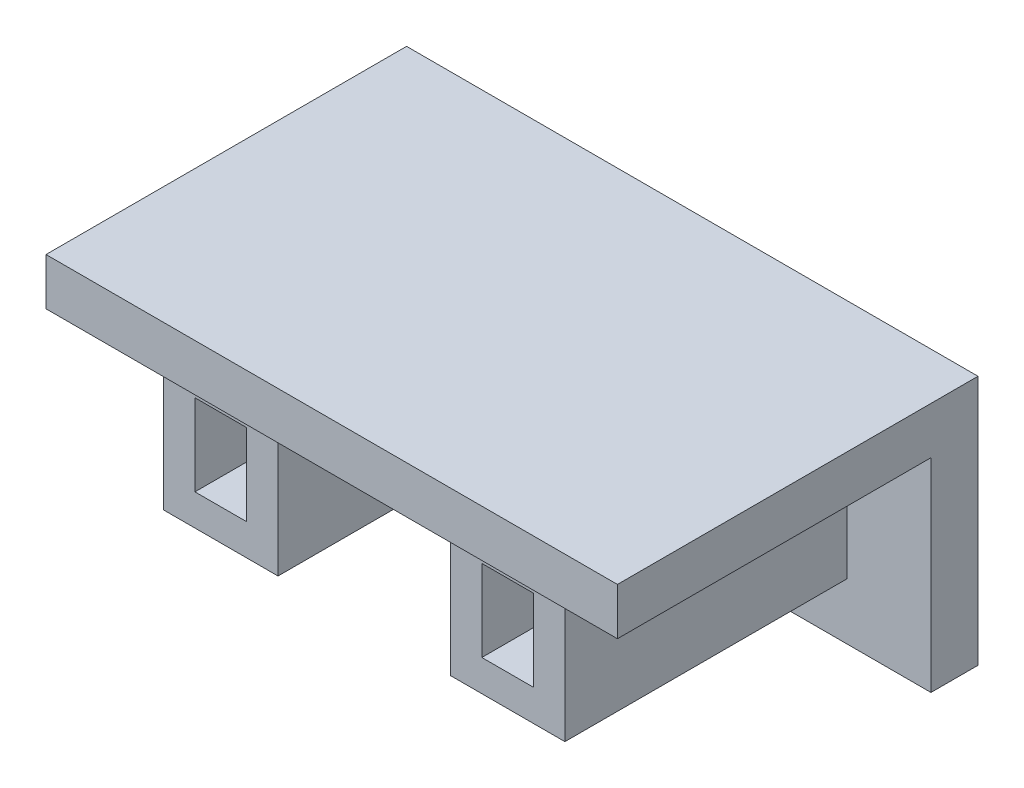
from build123d import *

# Parameters (mm, degrees)
SKETCH1_W              = 36.45
SKETCH1_H              = 25.4
BOSS_EXTRUDE1_DEPTH    = 3
CUT_EXTRUDE2_START     = -3
CUT_EXTRUDE2_OUTLINE_W = 3.3
CUT_EXTRUDE2_OUTLINE_H = 5.2
CUT_EXTRUDE2_DEPTH     = 3
SKETCH2_W              = 36.45
SKETCH2_H              = 3
BOSS_EXTRUDE3_DEPTH    = 20
SKETCH5_W              = 7.3
SKETCH5_H              = 9.361177697
SKETCH5_W_2            = 3.3
SKETCH5_H_2            = 5.2
BOSS_EXTRUDE4_DEPTH    = 18
SKETCH8_W              = 29.52669185
SKETCH8_H              = 10.957410593
CUT_EXTRUDE4_DEPTH     = 47.222944791


# Read off the part's stored shape, not the designer's step: Cut-Extrude2
with BuildPart() as part:
    # Sketch1 → Boss-Extrude1 (new body)
    with BuildSketch(Plane.XY):
        with Locations((15.565968828, -4.002039549)):
            Rectangle(SKETCH1_W, SKETCH1_H)
    extrude(amount=BOSS_EXTRUDE1_DEPTH)

    # Cut-Extrude2 outline → Cut-Extrude2 (cut)
    with BuildSketch(Plane.XY.offset(3).offset(CUT_EXTRUDE2_START)):
        with Locations((24.790968828, 0.936782754)):
            Rectangle(CUT_EXTRUDE2_OUTLINE_W, CUT_EXTRUDE2_OUTLINE_H)
        with Locations((6.490968828, 0.936782754)):
            Rectangle(CUT_EXTRUDE2_OUTLINE_W, CUT_EXTRUDE2_OUTLINE_H)
    extrude(amount=CUT_EXTRUDE2_DEPTH, mode=Mode.SUBTRACT)

    # Sketch2 → Boss-Extrude3 (add)
    with BuildSketch(Plane.XY.offset(3)):
        with Locations((15.565968828, 7.197960451)):
            Rectangle(SKETCH2_W, SKETCH2_H)
        with Locations((15.565968828, -15.202039549)):
            Rectangle(SKETCH2_W, SKETCH2_H)
    extrude(amount=BOSS_EXTRUDE3_DEPTH)

    # Sketch5 → Boss-Extrude4 (add)
    # profile 1 of 2: a face of its own
    with BuildSketch(Plane.XY.offset(3)):
        with Locations((6.490968828, 1.017371602)):
            Rectangle(SKETCH5_W, SKETCH5_H)
        with Locations((6.490968828, 0.936782754)):
            Rectangle(SKETCH5_W_2, SKETCH5_H_2, mode=Mode.SUBTRACT)
    # profile 2 of 2: a face of its own
    with BuildSketch(Plane.XY.offset(3)):
        with Locations((24.790968828, 1.017371602)):
            Rectangle(SKETCH5_W, SKETCH5_H)
        with Locations((24.790968828, 0.936782754)):
            Rectangle(SKETCH5_W_2, SKETCH5_H_2, mode=Mode.SUBTRACT)
    extrude(amount=BOSS_EXTRUDE4_DEPTH)

    # Sketch8 → Cut-Extrude4 (cut, through all)
    with BuildSketch(Plane(origin=(33.790968828, 0, 0), x_dir=(0, 0, -1), z_dir=(1, 0, 0))):
        with Locations((-9.750497468, -12.749552208)):
            Rectangle(SKETCH8_W, SKETCH8_H)
    extrude(amount=-CUT_EXTRUDE4_DEPTH, mode=Mode.SUBTRACT)


solid = part.part
